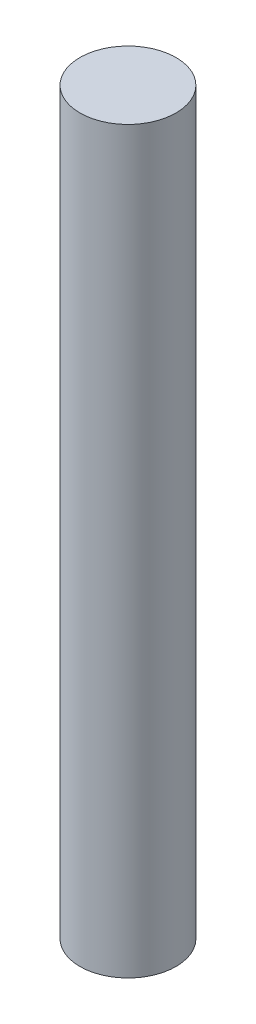
from build123d import *

# Parameters (mm, degrees)
SKETCH1_R           = 3.25
BOSS_EXTRUDE1_DEPTH = 50


with BuildPart() as part:
    # Sketch1 → Boss-Extrude1 (new body)
    with BuildSketch(Plane(origin=(0, 0, 0), x_dir=(1, 0, 0), z_dir=(0, 1, 0))):
        Circle(SKETCH1_R)
    extrude(amount=BOSS_EXTRUDE1_DEPTH)


solid = part.part
